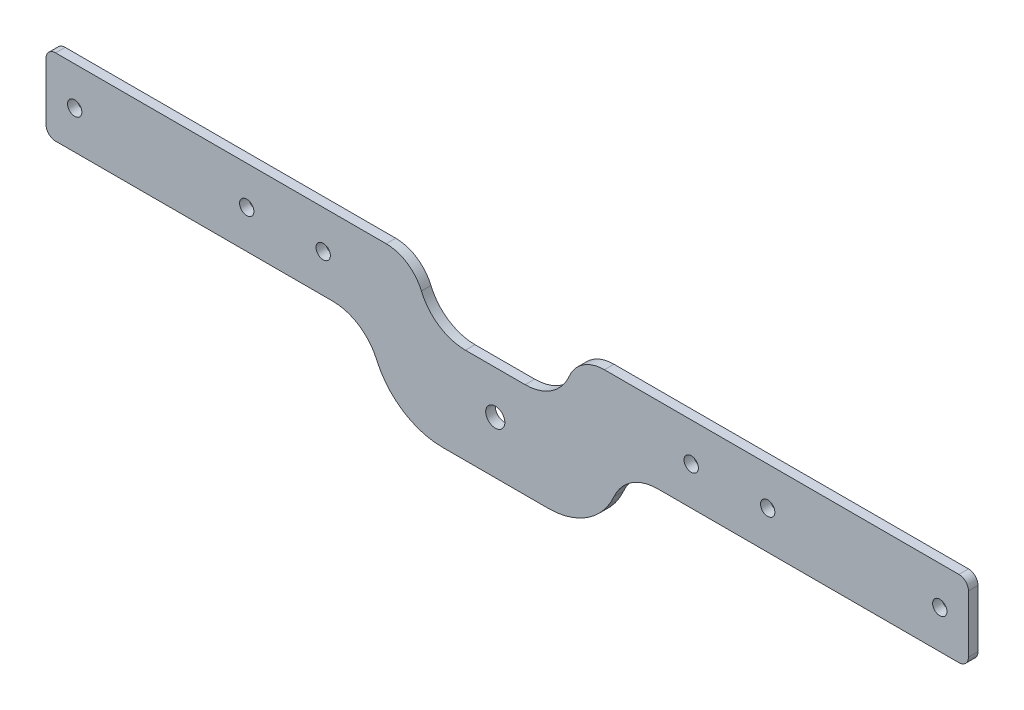
from build123d import *

# Parameters (mm, degrees)
SKETCH_1_R         = 2
SKETCH_1_R_2       = 1.5
EXTRUDE_4102_DEPTH = 2
FILLET_2_R         = 10
FILLET_3_R         = 15
FILLET_16_R        = 8
FILLET_18_R        = 2


with BuildPart() as part:
    # Sketch 1 → Extrude 4102 (new body)
    with BuildSketch(Plane.XY):
        with BuildLine():
            Line((-144.194872369, -16), (-222, -16))
            Line((-222, -16), (-222, -32))
            Line((-222, -32), (-152, -32))
            Line((-152, -32), (-152, -47))
            Line((-152, -47), (-104, -47))
            Line((-104, -47), (-104, -32))
            Line((-104, -32), (-29, -32))
            Line((-29, -32), (-29, -16))
            Line((-29, -16), (-111.805127631, -16))
            ThreePointArc((-111.805127631, -16), (-114.338803515, -23.708203932), (-121.755002002, -27))
            Line((-121.755002002, -27), (-134.244997998, -27))
            ThreePointArc((-134.244997998, -27), (-141.661196485, -23.708203932), (-144.194872369, -16))
        make_face()
        with Locations((-128, -36)):
            Circle(SKETCH_1_R, mode=Mode.SUBTRACT)
        with Locations((-216, -24)):
            Circle(SKETCH_1_R_2, mode=Mode.SUBTRACT)
        with Locations((-180, -24)):
            Circle(SKETCH_1_R_2, mode=Mode.SUBTRACT)
        with Locations((-164, -24)):
            Circle(SKETCH_1_R_2, mode=Mode.SUBTRACT)
        with Locations((-87, -24)):
            Circle(SKETCH_1_R_2, mode=Mode.SUBTRACT)
        with Locations((-71, -24)):
            Circle(SKETCH_1_R_2, mode=Mode.SUBTRACT)
        with Locations((-35, -24)):
            Circle(SKETCH_1_R_2, mode=Mode.SUBTRACT)
    extrude(amount=EXTRUDE_4102_DEPTH)

    # Скругление2
    fillet_2_edges = [part.edges().sort_by_distance(p)[0] for p in [
        (-104, -32, 1),
        (-152, -32, 1),
    ]]
    fillet(fillet_2_edges, radius=FILLET_2_R)

    # Скругление3
    fillet_3_edges = [part.edges().sort_by_distance(p)[0] for p in [
        (-152, -47, 1),
        (-104, -47, 1),
    ]]
    fillet(fillet_3_edges, radius=FILLET_3_R)

    # Скругление16
    fillet_16_edges = [part.edges().sort_by_distance(p)[0] for p in [
        (-111.805127631, -16, 1),
        (-144.194872369, -16, 1),
    ]]
    fillet(fillet_16_edges, radius=FILLET_16_R)

    # Скругление18
    fillet_18_edges = [part.edges().sort_by_distance(p)[0] for p in [
        (-29, -16, 1),
        (-222, -16, 1),
        (-29, -32, 1),
        (-222, -32, 1),
    ]]
    fillet(fillet_18_edges, radius=FILLET_18_R)


solid = part.part
